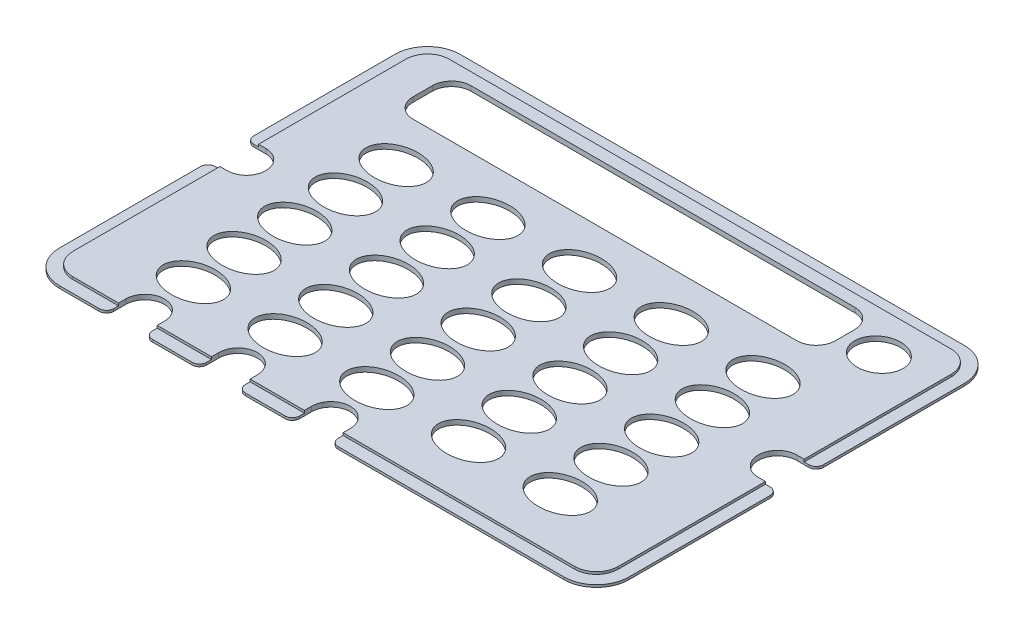
from build123d import *

# Parameters (mm, degrees)
SKETCH1_W                     = 236
SKETCH1_H                     = 166
OUTER_PROFILE_DEPTH           = 1
SKETCH2_W                     = 226
SKETCH2_H                     = 156
INNER_PROFILE_DEPTH           = 1
FILLET1_R                     = 9
FILLET2_R                     = 13.5
SKETCH3_RX                    = 12.5
SKETCH3_RY                    = 9
CUTOUT_DEPTH                  = 145.280975877
CUTOUTS_COUNT                 = 5
CUTOUTS_PITCH                 = 38
CUTOUTS_COUNT_DIR2            = 5
CUTOUTS_PITCH_DIR2            = 21
SIDE_CUTOUT_DEPTH             = 145.280976018
CUT_EXTRUDE1_DEPTH            = 10
BASE_CUTOUT_R                 = 3
BASE_CUTOUTS_COUNT            = 3
BASE_CUTOUTS_PITCH            = 38.5
BASE_CUTOUT_OF_BASE_CUTOUTS_R = 3
SKETCH9_RX                    = 10
SKETCH9_RY                    = 9
SKETCH9_W                     = 175
SKETCH9_H                     = 24
TOP_DEPTH                     = 145.280976018
FILLET4_R                     = 8
FILLET5_R                     = 3


with BuildPart() as part:
    # Sketch1 → Outer Profile (new body)
    with BuildSketch(Plane(origin=(0, 0, 0), x_dir=(1, 0, 0), z_dir=(0, 1, 0))):
        Rectangle(SKETCH1_W, SKETCH1_H)
    extrude(amount=OUTER_PROFILE_DEPTH)

    # Sketch2 → Inner Profile (add)
    with BuildSketch(Plane(origin=(0, 1, 0), x_dir=(1, 0, 0), z_dir=(0, 1, 0))):
        Rectangle(SKETCH2_W, SKETCH2_H)
    extrude(amount=INNER_PROFILE_DEPTH)

    # Fillet1
    fillet1_edges = [part.edges().sort_by_distance(p)[0] for p in [
        (113, 1.5, 78),
        (113, 1.5, -78),
        (-113, 1.5, -78),
        (-113, 1.5, 78),
    ]]
    fillet(fillet1_edges, radius=FILLET1_R)

    # Fillet2
    fillet2_edges = [part.edges().sort_by_distance(p)[0] for p in [
        (-118, 0.5, -83),
        (118, 0.5, -83),
        (118, 0.5, 83),
        (-118, 0.5, 83),
    ]]
    fillet(fillet2_edges, radius=FILLET2_R)

    # Sketch3 → Cutout (cut, through all)
    with BuildSketch(Plane(origin=(0, 2, 0), x_dir=(1, 0, 0), z_dir=(0, 1, 0))):
        with Locations(Location((-77, -55), (0, 0, 180))):
            Ellipse(SKETCH3_RX, SKETCH3_RY)
    cutout = extrude(amount=-CUTOUT_DEPTH, mode=Mode.SUBTRACT)

    # Cutouts: Cutout 5 × 5
    with Locations(*[(i * CUTOUTS_PITCH, 0, -j * CUTOUTS_PITCH_DIR2) for i in range(CUTOUTS_COUNT) for j in range(CUTOUTS_COUNT_DIR2) if (i, j) != (0, 0)]):
        add(cutout, mode=Mode.SUBTRACT)

    # Sketch6 → Side Cutout (cut, through all)
    with BuildSketch(Plane(origin=(0, 2, 0), x_dir=(1, 0, 0), z_dir=(0, 1, 0))):
        with BuildLine():
            Line((110, 8), (118, 8))
            Line((118, 8), (118, -8))
            Line((118, -8), (110, -8))
            ThreePointArc((110, -8), (102, 0), (110, 8))
        make_face()
        with BuildLine():
            Line((-110, 8), (-118, 8))
            Line((-118, 8), (-118, -8))
            Line((-118, -8), (-110, -8))
            ThreePointArc((-110, -8), (-102, 0), (-110, 8))
        make_face()
    extrude(amount=-SIDE_CUTOUT_DEPTH, mode=Mode.SUBTRACT)

    # Sketch8 → Cut-Extrude1 (cut)
    with BuildSketch(Plane(origin=(0, 2, 0), x_dir=(1, 0, 0), z_dir=(0, 1, 0))):
        with BuildLine():
            Line((-85, -83), (-85, -75))
            ThreePointArc((-85, -75), (-77, -67), (-69, -75))
            Line((-69, -75), (-69, -83))
            Line((-69, -83), (-85, -83))
        make_face()
    cut_extrude1 = extrude(amount=-CUT_EXTRUDE1_DEPTH, mode=Mode.SUBTRACT)

    # Base Cutout
    base_cutout_edges = [part.edges().sort_by_distance(p)[0] for p in [
        (-85, 0.5, 83),
        (-69, 0.5, 83),
    ]]
    fillet(base_cutout_edges, radius=BASE_CUTOUT_R)

    # Base Cutouts: Cut-Extrude1 ×3
    with Locations(*[(i * BASE_CUTOUTS_PITCH, 0, 0) for i in range(1, BASE_CUTOUTS_COUNT)]):
        add(cut_extrude1, mode=Mode.SUBTRACT)

    # Base Cutout of Base Cutouts
    base_cutout_of_base_cutouts_edges = [part.edges().sort_by_distance(p)[0] for p in [
        (-46.5, 0.5, 83),
        (-30.5, 0.5, 83),
        (-8, 0.5, 83),
        (8, 0.5, 83),
    ]]
    fillet(base_cutout_of_base_cutouts_edges, radius=BASE_CUTOUT_OF_BASE_CUTOUTS_R)

    # Sketch9 → Top (cut, through all)
    with BuildSketch(Plane(origin=(0, 2, 0), x_dir=(1, 0, 0), z_dir=(0, 1, 0))):
        with Locations((91, 61)):
            Ellipse(SKETCH9_RX, SKETCH9_RY)
        with Locations((-10.5, 61)):
            Rectangle(SKETCH9_W, SKETCH9_H)
    extrude(amount=-TOP_DEPTH, mode=Mode.SUBTRACT)

    # Fillet4
    fillet4_edges = [part.edges().sort_by_distance(p)[0] for p in [
        (-98, 1, -49),
        (-98, 1, -73),
        (77, 1, -49),
        (77, 1, -73),
    ]]
    fillet(fillet4_edges, radius=FILLET4_R)

    # Fillet5
    fillet5_edges = [part.edges().sort_by_distance(p)[0] for p in [
        (118, 0.5, 8),
        (118, 0.5, -8),
        (-118, 0.5, 8),
        (-118, 0.5, -8),
    ]]
    fillet(fillet5_edges, radius=FILLET5_R)


solid = part.part
